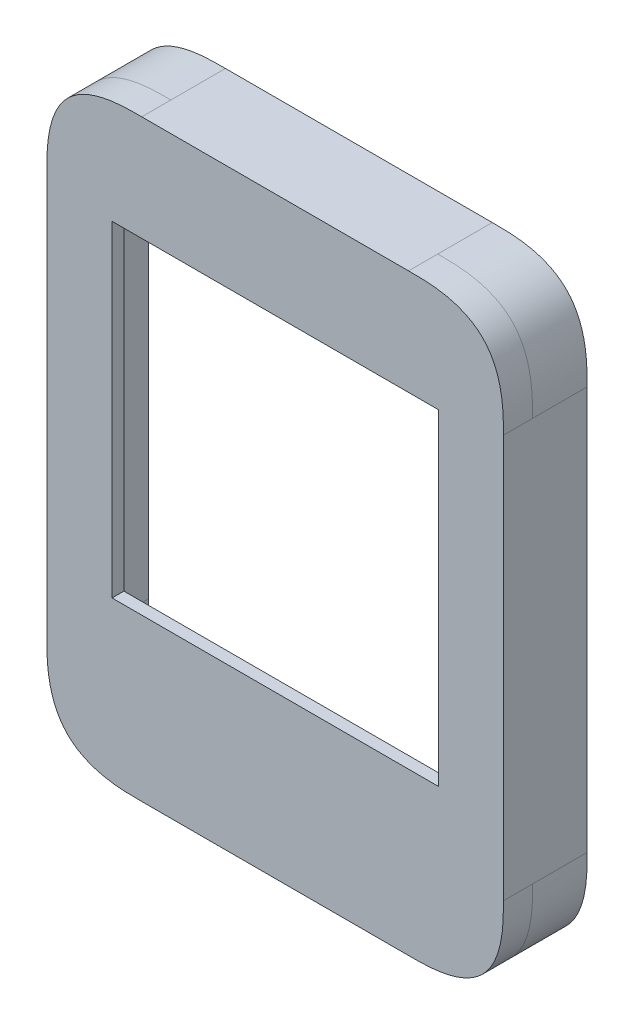
from build123d import *

# Parameters (mm, degrees)
SKETCH2_W           = 38.5
SKETCH2_H           = 50
BOSS_EXTRUDE1_DEPTH = 2.46
SKETCH3_W           = 27.51
SKETCH3_H           = 27.51
CUT_EXTRUDE1_DEPTH  = 32.648287473
CUT_EXTRUDE2_START  = -1.46
SKETCH4_W           = 32
SKETCH4_H           = 37.52
CUT_EXTRUDE2_DEPTH  = 1.46
FILLET1_SIZE        = 8
EXTRUDE_THIN1_DEPTH = 4.6000508


with BuildPart() as part:
    # Sketch2 → Boss-Extrude1 (new body)
    with BuildSketch(Plane.XY):
        Rectangle(SKETCH2_W, SKETCH2_H)
    extrude(amount=BOSS_EXTRUDE1_DEPTH)

    # Sketch3 → Cut-Extrude1 (cut, through all)
    with BuildSketch(Plane.XY.offset(2.46)):
        with Locations((0, 2.365)):
            Rectangle(SKETCH3_W, SKETCH3_H)
    extrude(amount=-CUT_EXTRUDE1_DEPTH, mode=Mode.SUBTRACT)

    # Sketch4 → Cut-Extrude2 (cut)
    with BuildSketch(Plane(origin=(0, 0, 0), x_dir=(-1, 0, 0), z_dir=(0, 0, -1)).offset(CUT_EXTRUDE2_START)):
        Rectangle(SKETCH4_W, SKETCH4_H)
    extrude(amount=CUT_EXTRUDE2_DEPTH, mode=Mode.SUBTRACT)

    # Fillet1
    # a fillet whose section is not a circle: 8 mm, written as the material it takes off along each edge
    with BuildSketch(Plane(origin=(19.25, -25, -20), x_dir=(0, 1, 0), z_dir=(0, 0, 1)), Plane(origin=(19.25, 25, -20), x_dir=(-1, 0, 0), z_dir=(0, 0, 1))) as fillet1_piece_1:
        with BuildLine():
            add(Edge.make_bspline([(FILLET1_SIZE, 0), (FILLET1_SIZE * 0.831801948466, 0), (FILLET1_SIZE * 0.663603896932, 0), (FILLET1_SIZE * 0.292893218813, FILLET1_SIZE * 0.0716919198361), (FILLET1_SIZE * 0.0716919198361, FILLET1_SIZE * 0.292893218813), (0, FILLET1_SIZE * 0.663603896932), (0, FILLET1_SIZE * 0.831801948466), (0, FILLET1_SIZE)], knots=[0, 0, 0, 0, 0, 0, 0.5, 0.5, 1, 1, 1, 1, 1, 1], degree=5))
            Line((0, FILLET1_SIZE), (0, 0))
            Line((0, 0), (FILLET1_SIZE, 0))
        make_face()
    extrude(amount=42.46, mode=Mode.SUBTRACT)
    with BuildSketch(Plane(origin=(-19.25, -25, -20), x_dir=(0, 1, 0), z_dir=(0, 0, 1)), Plane(origin=(-19.25, 25, -20), x_dir=(1, 0, 0), z_dir=(0, 0, 1))) as fillet1_piece_2:
        with BuildLine():
            add(Edge.make_bspline([(FILLET1_SIZE, 0), (FILLET1_SIZE * 0.831801948466, 0), (FILLET1_SIZE * 0.663603896932, 0), (FILLET1_SIZE * 0.292893218813, -FILLET1_SIZE * 0.0716919198361), (FILLET1_SIZE * 0.0716919198361, -FILLET1_SIZE * 0.292893218813), (0, -FILLET1_SIZE * 0.663603896932), (0, -FILLET1_SIZE * 0.831801948466), (0, -FILLET1_SIZE)], knots=[0, 0, 0, 0, 0, 0, 0.5, 0.5, 1, 1, 1, 1, 1, 1], degree=5))
            Line((0, -FILLET1_SIZE), (0, 0))
            Line((0, 0), (FILLET1_SIZE, 0))
        make_face()
    extrude(amount=42.46, mode=Mode.SUBTRACT)

    # Extrude-Thin1: read off the stored shape, not the designer's step
    # Extrude-Thin1 outline → Extrude-Thin1 (add)
    with BuildSketch(Plane(origin=(0, 0, 0), x_dir=(-1, 0, 0), z_dir=(0, 0, -1))):
        with BuildLine():
            Line((19.25, -17), (19.25, 17))
            add(Edge.make_bspline(
                [(19.25, 17), (19.25, 18.080020252), (19.21236359, 18.661838265), (19.154343151, 19.558771223), (18.987229849, 20.308455098), (18.574914705, 22.15813439), (17.495660449, 23.239618136), (16.416563674, 24.320944075), (14.566335811, 24.735468819), (13.817055919, 24.903337362), (12.9181968, 24.961950617), (12.334693381, 25), (11.25, 25)],
                knots=[0, 0, 0, 0.125, 0.125, 0.25, 0.25, 0.5, 0.5, 0.75, 0.75, 0.875, 0.875, 1, 1, 1], degree=2))
            Line((11.25, 25), (-11.25, 25))
            add(Edge.make_bspline(
                [(-11.25, 25), (-12.330020252, 25), (-12.911838265, 24.96236359), (-13.808771223, 24.904343151), (-14.558455098, 24.737229849), (-16.40813439, 24.324914706), (-17.489618136, 23.245660449), (-18.570944075, 22.166563674), (-18.985468819, 20.316335811), (-19.153337362, 19.567055919), (-19.211950617, 18.6681968), (-19.25, 18.084693381), (-19.25, 17)],
                knots=[0, 0, 0, 0.125, 0.125, 0.25, 0.25, 0.5, 0.5, 0.75, 0.75, 0.875, 0.875, 1, 1, 1], degree=2))
            Line((-19.25, 17), (-19.25, -17))
            add(Edge.make_bspline(
                [(-19.25, -17), (-19.25, -18.080020252), (-19.21236359, -18.661838265), (-19.154343151, -19.558771223), (-18.987229849, -20.308455098), (-18.574914705, -22.15813439), (-17.495660449, -23.239618136), (-16.416563674, -24.320944075), (-14.566335811, -24.735468819), (-13.817055919, -24.903337362), (-12.9181968, -24.961950617), (-12.334693381, -25), (-11.25, -25)],
                knots=[0, 0, 0, 0.125, 0.125, 0.25, 0.25, 0.5, 0.5, 0.75, 0.75, 0.875, 0.875, 1, 1, 1], degree=2))
            Line((-11.25, -25), (11.25, -25))
            add(Edge.make_bspline(
                [(11.25, -25), (12.330020252, -25), (12.911838265, -24.96236359), (13.808771223, -24.904343151), (14.558455098, -24.737229849), (16.40813439, -24.324914705), (17.489618136, -23.245660449), (18.570944075, -22.166563674), (18.985468819, -20.316335811), (19.153337362, -19.567055919), (19.211950617, -18.6681968), (19.25, -18.084693381), (19.25, -17)],
                knots=[0, 0, 0, 0.125, 0.125, 0.25, 0.25, 0.5, 0.5, 0.75, 0.75, 0.875, 0.875, 1, 1, 1], degree=2))
        make_face()
        with BuildLine():
            add(Edge.make_bspline(
                [(17.75, 17), (17.75, 17.910616857), (17.742803739, 18.820541265), (17.494766535, 20.162599542), (17.372269419, 20.610955669), (17.009948198, 21.449886938), (16.76260553, 21.8485376), (16.280287208, 22.3350229), (16.098458911, 22.481228553), (15.714737075, 22.732803098), (15.512153227, 22.839738566), (15.090310487, 23.024293387), (14.872783413, 23.101011181), (14.434691087, 23.229055253), (14.212929514, 23.280935234), (13.541087581, 23.407254361), (13.083137103, 23.45459729), (12.167192596, 23.497198895), (11.708640217, 23.5), (11.25, 23.5)],
                knots=[0, 0, 0, 0, 0.25, 0.25, 0.375, 0.375, 0.5, 0.5, 0.5625, 0.5625, 0.625, 0.625, 0.6875, 0.6875, 0.75, 0.75, 0.875, 0.875, 1, 1, 1, 1], degree=3))
            Line((17.75, 17), (17.75, -17))
            add(Edge.make_bspline(
                [(11.25, -23.5), (12.160616857, -23.5), (13.070541265, -23.492803739), (14.412599542, -23.244766535), (14.860955669, -23.122269419), (15.699886938, -22.759948198), (16.0985376, -22.51260553), (16.5850229, -22.030287208), (16.731228553, -21.848458911), (16.982803098, -21.464737075), (17.089738566, -21.262153227), (17.274293387, -20.840310487), (17.351011181, -20.622783413), (17.479055253, -20.184691087), (17.530935234, -19.962929514), (17.657254361, -19.291087581), (17.70459729, -18.833137103), (17.747198895, -17.917192596), (17.75, -17.458640217), (17.75, -17)],
                knots=[0, 0, 0, 0, 0.25, 0.25, 0.375, 0.375, 0.5, 0.5, 0.5625, 0.5625, 0.625, 0.625, 0.6875, 0.6875, 0.75, 0.75, 0.875, 0.875, 1, 1, 1, 1], degree=3))
            Line((11.25, -23.5), (-11.25, -23.5))
            add(Edge.make_bspline(
                [(-17.75, -17), (-17.75, -17.910616857), (-17.742803739, -18.820541265), (-17.494766535, -20.162599542), (-17.372269419, -20.610955669), (-17.009948198, -21.449886938), (-16.76260553, -21.8485376), (-16.280287208, -22.3350229), (-16.098458911, -22.481228553), (-15.714737075, -22.732803098), (-15.512153227, -22.839738566), (-15.090310487, -23.024293387), (-14.872783413, -23.101011181), (-14.434691087, -23.229055253), (-14.212929514, -23.280935234), (-13.541087581, -23.407254361), (-13.083137103, -23.45459729), (-12.167192596, -23.497198895), (-11.708640217, -23.5), (-11.25, -23.5)],
                knots=[0, 0, 0, 0, 0.25, 0.25, 0.375, 0.375, 0.5, 0.5, 0.5625, 0.5625, 0.625, 0.625, 0.6875, 0.6875, 0.75, 0.75, 0.875, 0.875, 1, 1, 1, 1], degree=3))
            Line((-17.75, -17), (-17.75, 17))
            add(Edge.make_bspline(
                [(-11.25, 23.5), (-12.160616857, 23.5), (-13.070541265, 23.492803739), (-14.412599542, 23.244766535), (-14.860955669, 23.122269419), (-15.699886938, 22.759948198), (-16.0985376, 22.51260553), (-16.5850229, 22.030287208), (-16.731228553, 21.848458911), (-16.982803098, 21.464737075), (-17.089738566, 21.262153227), (-17.274293387, 20.840310487), (-17.351011181, 20.622783413), (-17.479055253, 20.184691087), (-17.530935234, 19.962929514), (-17.657254361, 19.291087581), (-17.70459729, 18.833137103), (-17.747198895, 17.917192596), (-17.75, 17.458640217), (-17.75, 17)],
                knots=[0, 0, 0, 0, 0.25, 0.25, 0.375, 0.375, 0.5, 0.5, 0.5625, 0.5625, 0.625, 0.625, 0.6875, 0.6875, 0.75, 0.75, 0.875, 0.875, 1, 1, 1, 1], degree=3))
            Line((-11.25, 23.5), (11.25, 23.5))
        make_face(mode=Mode.SUBTRACT)
    extrude(amount=EXTRUDE_THIN1_DEPTH)


solid = part.part
